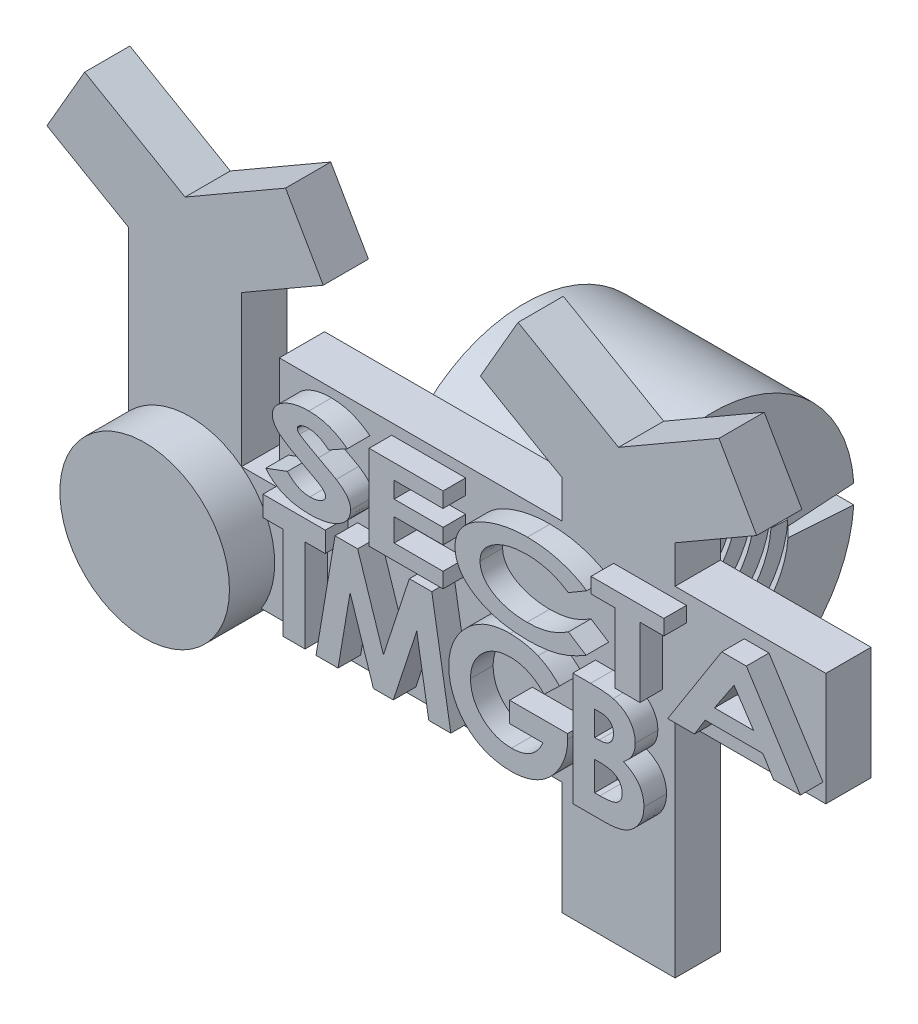
from build123d import *

# Parameters (mm, degrees)
SALIENTE_EXTRUIR1_DEPTH      = 2.4
SALIENTE_EXTRUIR2_DEPTH      = 2.4
SALIENTE_EXTRUIR2_DEPTH_BACK = 2.4
CROQUIS2_R                   = 4.5
SALIENTE_EXTRUIR3_DEPTH      = 1.2
SALIENTE_EXTRUIR4_START      = -15.5
SALIENTE_EXTRUIR4_DEPTH      = 10
REVOLUCI_N2_ANGLE            = 352.37185
SALIENTE_EXTRUIR5_DEPTH      = 1.2


# Read off the part's stored shape, not the designer's step: Revolución2
with BuildPart() as part:
    # Croquis1 → Saliente-Extruir1 (new body)
    with BuildSketch(Plane.XY):
        Polygon((-8, -12), (-14, -12), (-14, -6), (-37, -6), (-37, 8), (-41.330127019, 10.5), (-39.330127019, 13.964101615), (-34, 10.886751346), (-28.669872981, 13.964101615), (-26.669872981, 10.5), (-31, 8), (-31, 0), (-29, 0), (-29, 6), (-14, 6), (-14, 8), (-18.330127019, 10.5), (-16.330127019, 13.964101615), (-11, 10.886751346), (-5.669872981, 13.964101615), (-3.669872981, 10.5), (-8, 8), (-8, 6), (0, 6), (0, 0), (-8, 0), align=None)
    extrude(amount=SALIENTE_EXTRUIR1_DEPTH)

    # Croquis2 → Saliente-Extruir2 (add, two sides: drawn at the far end of the back side and taken through both)
    with BuildSketch(Plane.XY.offset(2.4).offset(-SALIENTE_EXTRUIR2_DEPTH_BACK)):
        with Locations((-33.744908232, -3.565877002)):
            Circle(CROQUIS2_R)
    extrude(amount=SALIENTE_EXTRUIR2_DEPTH + SALIENTE_EXTRUIR2_DEPTH_BACK)

    # Croquis4 → Saliente-Extruir3 (add)
    # profile 1 of 5: a face of its own
    with BuildSketch(Plane.XY.offset(2.4)):
        with BuildLine():
            Line((-24.192307692, 4.825075565), (-25.183894231, 4.27249143))
            add(Edge.make_bspline(
                [(-25.183894231, 4.27249143), (-25.226919521, 4.309235401), (-25.310921586, 4.380973891), (-25.44300624, 4.474503478), (-25.57494017, 4.554736812), (-25.707934149, 4.620047496), (-25.841884622, 4.67105453), (-25.976583426, 4.707083688), (-26.111905597, 4.729870519), (-26.20243685, 4.732645607), (-26.247596154, 4.734029892)],
                knots=[0, 0, 0, 0, 1.144796943, 2.235087903, 3.271950806, 4.267549238, 5.230026978, 6.168390537, 7.086346384, 8, 8, 8, 8], degree=3))
            add(Edge.make_bspline(
                [(-26.247596154, 4.734029892), (-26.289424602, 4.733153893), (-26.369562474, 4.731475594), (-26.484031555, 4.714354255), (-26.586771926, 4.685665755), (-26.6761846, 4.647005328), (-26.748660996, 4.600831216), (-26.803911953, 4.552167689), (-26.838911098, 4.497375224), (-26.84382007, 4.457984847), (-26.846153846, 4.439258257)],
                knots=[0, 0, 0, 0, 1.392129176, 2.667138632, 3.84227936, 4.935454925, 5.89858118, 6.691521191, 7.377935727, 8, 8, 8, 8], degree=3))
            add(Edge.make_bspline(
                [(-26.846153846, 4.439258257), (-26.844845537, 4.420373796), (-26.842149476, 4.381458201), (-26.816134665, 4.325733024), (-26.777704966, 4.271256116), (-26.742929276, 4.240270627), (-26.724459135, 4.223813546)],
                knots=[0, 0, 0, 0, 0.882707917, 1.819014285, 2.841630067, 4, 4, 4, 4], degree=3))
            add(Edge.make_bspline(
                [(-26.724459135, 4.223813546), (-26.70716928, 4.210697442), (-26.66689923, 4.180148536), (-26.59337581, 4.132820466), (-26.500289619, 4.0742192), (-26.385267259, 4.007155467), (-26.250202075, 3.929117481), (-26.092994818, 3.843681459), (-25.91659167, 3.74531642), (-25.790990693, 3.678511715), (-25.724759615, 3.643284699)],
                knots=[0, 0, 0, 0, 0.450074539, 1.048275106, 1.812777656, 2.732189609, 3.810011812, 5.048794557, 6.443789853, 8, 8, 8, 8], degree=3))
            add(Edge.make_bspline(
                [(-25.724759615, 3.643284699), (-25.662851598, 3.61054962), (-25.545567289, 3.548533238), (-25.379215317, 3.460234009), (-25.232592385, 3.380629208), (-25.104381152, 3.311837263), (-24.996313352, 3.251000464), (-24.90672063, 3.20082688), (-24.836479309, 3.15950506), (-24.796241404, 3.134624323), (-24.779146635, 3.12405393)],
                knots=[0, 0, 0, 0, 1.557729856, 2.951108395, 4.189202345, 5.268860485, 6.187465346, 6.947688418, 7.552933379, 8, 8, 8, 8], degree=3))
            add(Edge.make_bspline(
                [(-24.779146635, 3.12405393), (-24.745624529, 3.102367723), (-24.680599264, 3.060301409), (-24.588625488, 2.994912237), (-24.503390955, 2.931503644), (-24.427229566, 2.867043774), (-24.357014925, 2.805015658), (-24.29466236, 2.742739252), (-24.239952943, 2.680948997), (-24.177464976, 2.600954471), (-24.114353967, 2.498189698), (-24.058957494, 2.368077238), (-24.025432867, 2.231810055), (-24.021303487, 2.138659077), (-24.019230769, 2.091902488)],
                knots=[0, 0, 0, 0, 1.070878652, 2.077261218, 3.026806543, 3.919535016, 4.752941277, 5.539501526, 6.28186576, 6.965498631, 8.260851439, 9.503440935, 10.746866769, 12, 12, 12, 12], degree=3))
            add(Edge.make_bspline(
                [(-24.019230769, 2.091902488), (-24.021225883, 2.046388603), (-24.025162066, 1.956593709), (-24.053916989, 1.824825276), (-24.101962891, 1.699615496), (-24.170078124, 1.580956355), (-24.25688378, 1.468643362), (-24.361997442, 1.361487696), (-24.488019379, 1.263070384), (-24.629645969, 1.169520308), (-24.787082803, 1.085611466), (-24.956963559, 1.011461598), (-25.138821289, 0.94934789), (-25.33212297, 0.899368812), (-25.536835489, 0.859635813), (-25.752947944, 0.83114072), (-25.980779388, 0.81366997), (-26.136386151, 0.811872926), (-26.216045673, 0.810952969)],
                knots=[0, 0, 0, 0, 0.778645729, 1.536199556, 2.296471887, 3.065788088, 3.869161519, 4.720163113, 5.627776405, 6.600599383, 7.622238928, 8.677086202, 9.770036052, 10.907689888, 12.091823603, 13.337058766, 14.636764725, 16, 16, 16, 16], degree=3))
            add(Edge.make_bspline(
                [(-26.216045673, 0.810952969), (-26.278862692, 0.811613903), (-26.402188738, 0.812911487), (-26.584138058, 0.824072309), (-26.75981156, 0.841825212), (-26.929760665, 0.867140244), (-27.09350231, 0.899245573), (-27.251131566, 0.939142332), (-27.402545238, 0.985888772), (-27.54819372, 1.039742336), (-27.687679504, 1.102538784), (-27.822154113, 1.17262053), (-27.951366726, 1.251594628), (-28.076264597, 1.337864302), (-28.194814057, 1.433872974), (-28.309206927, 1.536758813), (-28.417527902, 1.648872099), (-28.485118563, 1.728831552), (-28.519230769, 1.769186142)],
                knots=[0, 0, 0, 0, 1.1656978, 2.288566092, 3.381684239, 4.4416263, 5.476209922, 6.477059963, 7.457759757, 8.415892537, 9.356930802, 10.29479133, 11.228214832, 12.165660798, 13.10971789, 14.057260176, 15.019522194, 16, 16, 16, 16], degree=3))
            Line((-28.519230769, 1.769186142), (-27.369891827, 2.195568353))
            add(Edge.make_bspline(
                [(-27.369891827, 2.195568353), (-27.326878803, 2.149617425), (-27.242766395, 2.059759915), (-27.104823389, 1.942623324), (-26.962827441, 1.842220632), (-26.815241766, 1.760731057), (-26.662944246, 1.696978834), (-26.505695985, 1.651714203), (-26.343252193, 1.623681536), (-26.232984667, 1.620335505), (-26.177283654, 1.618645276)],
                knots=[0, 0, 0, 0, 1.104549774, 2.159958392, 3.171518491, 4.154034384, 5.11440821, 6.064653456, 7.02237072, 8, 8, 8, 8], degree=3))
            add(Edge.make_bspline(
                [(-26.177283654, 1.618645276), (-26.120989658, 1.62005089), (-26.012343754, 1.622763687), (-25.85664514, 1.64771586), (-25.713942821, 1.686386449), (-25.607218871, 1.734622992), (-25.53095931, 1.778258902), (-25.482277778, 1.812604775), (-25.440114595, 1.847701985), (-25.405740827, 1.884529266), (-25.378809327, 1.92260654), (-25.360756038, 1.962489796), (-25.347985789, 2.003075864), (-25.346761569, 2.031110582), (-25.346153846, 2.045027488)],
                knots=[0, 0, 0, 0, 2.000080528, 3.860101882, 5.591711695, 7.241573856, 8.007496713, 8.712915002, 9.3571957, 9.95440764, 10.499672279, 11.006310789, 11.506715953, 12, 12, 12, 12], degree=3))
            add(Edge.make_bspline(
                [(-25.346153846, 2.045027488), (-25.348239201, 2.070942283), (-25.352586387, 2.124964954), (-25.390964671, 2.203007862), (-25.448179949, 2.280722516), (-25.514214503, 2.343308112), (-25.582059449, 2.395058844), (-25.647383562, 2.441422812), (-25.726444628, 2.492094868), (-25.819005406, 2.548325637), (-25.925335169, 2.609220624), (-26.044860486, 2.67577012), (-26.17800202, 2.747266769), (-26.271568792, 2.795754085), (-26.320612981, 2.821169315)],
                knots=[0, 0, 0, 0, 0.719620744, 1.500140495, 2.382110041, 3.407752025, 4.023146351, 4.762800511, 5.641737031, 6.64237355, 7.784062873, 9.059959673, 10.45894125, 12, 12, 12, 12], degree=3))
            add(Edge.make_bspline(
                [(-26.320612981, 2.821169315), (-26.368459463, 2.84567455), (-26.462008447, 2.89358695), (-26.598052081, 2.966124363), (-26.728282458, 3.035606872), (-26.852361866, 3.102717503), (-26.969340368, 3.16861793), (-27.079874913, 3.232097137), (-27.184213841, 3.292789495), (-27.281477135, 3.352655417), (-27.372939784, 3.409563727), (-27.457987116, 3.463803993), (-27.536153138, 3.516806133), (-27.608250882, 3.56691886), (-27.673715651, 3.615399427), (-27.732827542, 3.661463412), (-27.784903573, 3.705640291), (-27.845809442, 3.760123378), (-27.91153798, 3.827869305), (-27.981090217, 3.909608617), (-28.039650506, 3.991311051), (-28.088116794, 4.07325264), (-28.126508849, 4.154820462), (-28.152520589, 4.237055511), (-28.169956374, 4.318632083), (-28.172042788, 4.37336685), (-28.173076923, 4.400496238)],
                knots=[0, 0, 0, 0, 1.527752317, 2.987046655, 4.381534809, 5.722815918, 6.996037519, 8.197198144, 9.345466108, 10.426340658, 11.442891163, 12.407010941, 13.292840506, 14.126765819, 14.902190045, 15.60773904, 16.256140062, 16.842652159, 17.929649168, 18.935598672, 19.890598399, 20.782540177, 21.638432253, 22.445922123, 23.229718433, 24, 24, 24, 24], degree=3))
            add(Edge.make_bspline(
                [(-28.173076923, 4.400496238), (-28.171332958, 4.439115335), (-28.167872434, 4.515746655), (-28.140274372, 4.628176318), (-28.096954996, 4.736645399), (-28.034402099, 4.840036268), (-27.954790236, 4.939178338), (-27.857594728, 5.03372198), (-27.743147048, 5.123864571), (-27.613030887, 5.208721489), (-27.469978861, 5.28611098), (-27.317394775, 5.354995406), (-27.156225026, 5.412373324), (-26.987382795, 5.460394313), (-26.810220466, 5.497174122), (-26.625035089, 5.523120736), (-26.431752744, 5.538517619), (-26.300208347, 5.540640417), (-26.233173077, 5.541722199)],
                knots=[0, 0, 0, 0, 0.750986067, 1.490170878, 2.240724014, 3.017156197, 3.83291239, 4.709793601, 5.650705905, 6.664670556, 7.729957895, 8.813839263, 9.920261115, 11.057155333, 12.228423976, 13.439459984, 14.695144019, 16, 16, 16, 16], degree=3))
            add(Edge.make_bspline(
                [(-26.233173077, 5.541722199), (-26.1459499, 5.539811999), (-25.973426712, 5.536033716), (-25.71789947, 5.506014802), (-25.468743649, 5.458927461), (-25.265554368, 5.401927605), (-25.104286181, 5.345639344), (-24.980879285, 5.295174591), (-24.855593259, 5.235928582), (-24.726973154, 5.170437519), (-24.596827454, 5.094993964), (-24.463217184, 5.013324641), (-24.327779063, 4.922853281), (-24.238080357, 4.85811241), (-24.192307692, 4.825075565)],
                knots=[0, 0, 0, 0, 1.424089512, 2.816779558, 4.195891129, 5.561527259, 6.25835624, 6.984627267, 7.737611116, 8.521108524, 9.34096556, 10.193521101, 11.07816558, 12, 12, 12, 12], degree=3))
        make_face()
    # profile 2 of 5: a face of its own
    with BuildSketch(Plane.XY.offset(2.4)):
        Polygon((-23.035576923, 5.426337584), (-19.1125, 5.426337584), (-19.1125, 4.618645276), (-21.708653846, 4.618645276), (-21.708653846, 3.753260661), (-19.1125, 3.753260661), (-19.1125, 2.945568353), (-21.708653846, 2.945568353), (-21.708653846, 1.734029892), (-19.1125, 1.734029892), (-19.1125, 0.926337584), (-23.035576923, 0.926337584), align=None)
    # profile 3 of 5: a face of its own
    with BuildSketch(Plane.XY.offset(2.4)):
        with BuildLine():
            Line((-11.494230769, 4.645688546), (-12.461478365, 4.079582776))
            add(Edge.make_bspline(
                [(-12.461478365, 4.079582776), (-12.544289436, 4.131887712), (-12.70893723, 4.235882169), (-12.967709373, 4.369570214), (-13.2349627, 4.481070871), (-13.508945238, 4.574844948), (-13.791643594, 4.64568237), (-14.081359757, 4.697070998), (-14.379043474, 4.728675173), (-14.580090964, 4.732231823), (-14.681730769, 4.734029892)],
                knots=[0, 0, 0, 0, 1.000465043, 1.98915872, 2.971640436, 3.957111076, 4.945256385, 5.94622067, 6.961709345, 8, 8, 8, 8], degree=3))
            add(Edge.make_bspline(
                [(-14.681730769, 4.734029892), (-14.766807302, 4.732614733), (-14.933613121, 4.729840095), (-15.178736129, 4.708948819), (-15.41352726, 4.673751146), (-15.638708179, 4.625507751), (-15.853448947, 4.562274824), (-16.058280977, 4.48569033), (-16.25235326, 4.394501415), (-16.434067486, 4.290723345), (-16.600277398, 4.177562223), (-16.746196027, 4.055929366), (-16.870201552, 3.927577603), (-16.971329203, 3.792162), (-17.051341788, 3.650423272), (-17.107374496, 3.501164008), (-17.142253146, 3.345315182), (-17.146123081, 3.239018692), (-17.148076923, 3.185352007)],
                knots=[0, 0, 0, 0, 1.273167119, 2.496242804, 3.678550535, 4.824339787, 5.939965159, 7.025799381, 8.094030328, 9.145459928, 10.154579224, 11.099447358, 11.983659447, 12.819211474, 13.622469174, 14.41092516, 15.197712182, 16, 16, 16, 16], degree=3))
            add(Edge.make_bspline(
                [(-17.148076923, 3.185352007), (-17.147415614, 3.147727083), (-17.146108387, 3.073352918), (-17.129475318, 2.96370395), (-17.106065882, 2.856804626), (-17.070101266, 2.75393244), (-17.025862091, 2.65391101), (-16.971328936, 2.557174091), (-16.907261742, 2.463244728), (-16.833169017, 2.37324015), (-16.74995472, 2.287330187), (-16.657794645, 2.206639788), (-16.558275277, 2.129695963), (-16.45080782, 2.057129788), (-16.334226304, 1.991157083), (-16.210216908, 1.928324455), (-16.077791861, 1.871334993), (-15.938537212, 1.817777173), (-15.792564168, 1.771701839), (-15.642458064, 1.729774273), (-15.487700082, 1.69568223), (-15.329102464, 1.668203354), (-15.166867918, 1.644955994), (-15.000433419, 1.63053195), (-14.830012806, 1.619621949), (-14.714802376, 1.618973486), (-14.656490385, 1.618645276)],
                knots=[0, 0, 0, 0, 0.830945717, 1.642551973, 2.446594014, 3.246896049, 4.046756933, 4.861591236, 5.698014292, 6.556999256, 7.435410672, 8.338952563, 9.262321444, 10.214761384, 11.20258315, 12.221471147, 13.286409055, 14.388022435, 15.518142965, 16.668710983, 17.832243558, 19.019275871, 20.22635821, 21.453738207, 22.71124865, 24, 24, 24, 24], degree=3))
            add(Edge.make_bspline(
                [(-14.656490385, 1.618645276), (-14.558479025, 1.620411909), (-14.366006122, 1.623881189), (-14.084005172, 1.650038065), (-13.814796067, 1.694421697), (-13.598352905, 1.745650094), (-13.428470487, 1.797304223), (-13.29967663, 1.845079594), (-13.16705737, 1.897774166), (-13.031696922, 1.95876245), (-12.892716193, 2.025958407), (-12.751716033, 2.102246686), (-12.606883075, 2.184160309), (-12.51058721, 2.243056557), (-12.461478365, 2.273092392)],
                knots=[0, 0, 0, 0, 1.517099692, 2.97925243, 4.379421106, 5.737784246, 6.419017464, 7.126793621, 7.863581755, 8.627744198, 9.42450828, 10.252748223, 11.108938718, 12, 12, 12, 12], degree=3))
            Line((-12.461478365, 2.273092392), (-11.523978365, 1.670027488))
            add(Edge.make_bspline(
                [(-11.523978365, 1.670027488), (-11.589866389, 1.63089097), (-11.719693426, 1.55377562), (-11.915195728, 1.446317988), (-12.108473976, 1.34948377), (-12.297754192, 1.259261056), (-12.485165811, 1.179927018), (-12.670221171, 1.111080552), (-12.851582723, 1.048595885), (-13.032422653, 0.997560002), (-13.21480409, 0.952437403), (-13.402047536, 0.915306611), (-13.595238215, 0.882366907), (-13.794974582, 0.856691538), (-14.000848718, 0.835695517), (-14.213133376, 0.821796079), (-14.43134112, 0.812187513), (-14.578955449, 0.81136827), (-14.653786058, 0.810952969)],
                knots=[0, 0, 0, 0, 1.116919084, 2.20079896, 3.250609473, 4.267388355, 5.256504417, 6.215552819, 7.144850743, 8.051425286, 8.95323759, 9.882566473, 10.832956071, 11.809130983, 12.817090507, 13.848664173, 14.909416376, 16, 16, 16, 16], degree=3))
            add(Edge.make_bspline(
                [(-14.653786058, 0.810952969), (-14.722906065, 0.811438621), (-14.859691786, 0.812399709), (-15.062555949, 0.821077022), (-15.260983826, 0.833250386), (-15.454582999, 0.851296303), (-15.643403282, 0.874597786), (-15.827259539, 0.903853507), (-16.00674088, 0.936332544), (-16.180825441, 0.976788095), (-16.350605366, 1.020454944), (-16.515219787, 1.070284035), (-16.675796791, 1.124137214), (-16.830986852, 1.184720215), (-16.98194907, 1.249284398), (-17.127583541, 1.320151969), (-17.268666888, 1.395536662), (-17.404785058, 1.475557845), (-17.533832281, 1.55977608), (-17.655328935, 1.647304488), (-17.767608154, 1.738530782), (-17.872942194, 1.831381532), (-17.969705449, 1.927659287), (-18.056733746, 2.028066389), (-18.136984543, 2.130125749), (-18.207982429, 2.23578825), (-18.271536331, 2.343875109), (-18.325588208, 2.45528507), (-18.371881381, 2.569350723), (-18.409889173, 2.686463496), (-18.438566401, 2.80681331), (-18.459258447, 2.929679867), (-18.472299239, 3.055565471), (-18.474092593, 3.140548909), (-18.475, 3.183549122)],
                knots=[0, 0, 0, 0, 1.332695775, 2.637351488, 3.914573827, 5.165626706, 6.385872522, 7.582268218, 8.755001435, 9.901903064, 11.027533841, 12.134657037, 13.217484645, 14.292362361, 15.346028539, 16.38254251, 17.414187142, 18.429713001, 19.426050768, 20.38448865, 21.315585414, 22.214377371, 23.09110566, 23.945180852, 24.774994998, 25.592932072, 26.397837579, 27.190746929, 27.978303889, 28.769836126, 29.562406716, 30.361557218, 31.170975064, 32, 32, 32, 32], degree=3))
            add(Edge.make_bspline(
                [(-18.475, 3.183549122), (-18.473785493, 3.238925736), (-18.471371684, 3.348985679), (-18.446835338, 3.511020848), (-18.408980933, 3.668635775), (-18.355790343, 3.821267368), (-18.28636546, 3.9692084), (-18.202723551, 4.112393918), (-18.103189381, 4.250700647), (-17.988581396, 4.383672271), (-17.859872774, 4.511467458), (-17.71720785, 4.632192986), (-17.563026633, 4.748488266), (-17.393828314, 4.855888833), (-17.21236255, 4.957872305), (-17.017950151, 5.05352182), (-16.810256436, 5.142613144), (-16.59063275, 5.224912925), (-16.362332555, 5.299148216), (-16.12837035, 5.364251973), (-15.889855412, 5.419259798), (-15.647178925, 5.464408476), (-15.399824695, 5.498220768), (-15.148529856, 5.52396688), (-14.892531391, 5.538130641), (-14.720508462, 5.540519988), (-14.633954327, 5.541722199)],
                knots=[0, 0, 0, 0, 0.802734483, 1.595419208, 2.3713548, 3.151550955, 3.93542733, 4.738280132, 5.553519112, 6.40352961, 7.281897666, 8.181549112, 9.112540013, 10.080976543, 11.086002615, 12.130796417, 13.222189586, 14.362844853, 15.53167316, 16.70335042, 17.8843298, 19.081152094, 20.282513389, 21.504662868, 22.744459539, 24, 24, 24, 24], degree=3))
            add(Edge.make_bspline(
                [(-14.633954327, 5.541722199), (-14.560022202, 5.541038651), (-14.412680101, 5.539676383), (-14.192915704, 5.528419291), (-13.974866237, 5.510811627), (-13.759430794, 5.484144557), (-13.545483627, 5.45221806), (-13.334339569, 5.411070758), (-13.124506008, 5.364772576), (-12.918162654, 5.309484781), (-12.715876611, 5.248900726), (-12.520332919, 5.18093532), (-12.331084533, 5.108255242), (-12.149648163, 5.028005632), (-11.974851405, 4.94211841), (-11.807351876, 4.850530483), (-11.646999565, 4.75209108), (-11.544984001, 4.681037862), (-11.494230769, 4.645688546)],
                knots=[0, 0, 0, 0, 1.07027023, 2.132981633, 3.184963682, 4.2365859, 5.275089204, 6.31594048, 7.35020766, 8.385325281, 9.407824875, 10.406591267, 11.38165812, 12.34189163, 13.277662355, 14.200461515, 15.104720988, 16, 16, 16, 16], degree=3))
        make_face()
    # profile 4 of 5: a face of its own
    with BuildSketch(Plane.XY.offset(2.4)):
        Polygon((-11.260576923, 5.426337584), (-7.395192308, 5.426337584), (-7.395192308, 4.618645276), (-8.664423077, 4.618645276), (-8.664423077, 0.926337584), (-9.991346154, 0.926337584), (-9.991346154, 4.618645276), (-11.260576923, 4.618645276), align=None)
    # profile 5 of 5: a face of its own
    with BuildSketch(Plane.XY.offset(2.4)):
        Polygon((-4.322896635, 5.426337584), (-3.017608173, 5.426337584), (-0.151923077, 0.926337584), (-1.574399038, 0.926337584), (-2.138701923, 1.849414507), (-5.204507212, 1.849414507), (-5.768810096, 0.926337584), (-7.190384615, 0.926337584), align=None)
        Polygon((-3.671153846, 4.219306334), (-4.710516827, 2.657106815), (-2.631790865, 2.657106815), align=None, mode=Mode.SUBTRACT)
    extrude(amount=SALIENTE_EXTRUIR3_DEPTH)

    # Croquis5 → Saliente-Extruir4 (add)
    with BuildSketch(Plane.ZY.offset(29).offset(SALIENTE_EXTRUIR4_START)):
        with BuildLine():
            Line((0, 5.499090834), (0, -5.499090834))
            ThreePointArc((0, -5.499090834), (-7.869590412, -6.969890168), (-12.583388684, -0.498892579))
            Line((-12.583388684, -0.498892579), (-10.088925789, -0.332595053))
            ThreePointArc((-10.088925789, -0.332595053), (-0.1, 0), (-10.088925789, 0.332595053))
            Line((-10.088925789, 0.332595053), (-12.583388684, 0.498892579))
            ThreePointArc((-12.583388684, 0.498892579), (-7.869590412, 6.969890168), (0, 5.499090834))
        make_face()
    extrude(amount=SALIENTE_EXTRUIR4_DEPTH)

    # Revolución2 outline → Revolución2 (revolve)
    with BuildSketch(Plane(origin=(0, 0, -5.1), x_dir=(0, 0.06651901052375865, -0.9977851578566099), z_dir=(0, -0.9977851578566099, -0.06651901052375865))):
        Polygon((4.9, -22.6), (4, -23.5), (5, -23.5), (5, -18.9), (4, -19.9), (4.9, -19.9), (4, -20.8), (4.9, -20.8), (4, -21.7), (4.9, -21.7), (4, -22.6), align=None)
        Polygon((4, -17.1), (5, -18.1), (5, -13.5), (4, -13.5), (4.9, -14.4), (4, -14.4), (4.9, -15.3), (4, -15.3), (4.9, -16.2), (4, -16.2), (4.9, -17.1), align=None)
    revolve(axis=Axis((0, 0, -5.1), (1, 0, 0)), revolution_arc=REVOLUCI_N2_ANGLE)

    # Croquis8 → Saliente-Extruir5 (add)
    # profile 1 of 4: a face of its own
    with BuildSketch(Plane.XY.offset(2.4)):
        Polygon((-28.667985155, 0.5), (-25.360292848, 0.5), (-25.360292848, -0.576923077), (-26.437215925, -0.576923077), (-26.437215925, -5.5), (-27.591062079, -5.5), (-27.591062079, -0.576923077), (-28.667985155, -0.576923077), align=None)
    # profile 2 of 4: a face of its own
    with BuildSketch(Plane.XY.offset(2.4)):
        Polygon((-24.842985155, 0.5), (-23.642264002, 0.5), (-22.275677463, -3.685096154), (-20.900677463, 0.5), (-19.709571694, 0.5), (-18.698754386, -5.5), (-19.86822554, -5.5), (-20.506446694, -1.710336538), (-21.751639002, -5.5), (-22.806927463, -5.5), (-24.044908232, -1.710336538), (-24.683129386, -5.5), (-25.85260054, -5.5), align=None)
    # profile 3 of 4: a face of its own
    with BuildSketch(Plane.XY.offset(2.4)):
        with BuildLine():
            Line((-12.93385054, -0.454326923), (-13.747552463, -1.234375))
            add(Edge.make_bspline(
                [(-13.747552463, -1.234375), (-13.812112854, -1.169830889), (-13.938570004, -1.043405626), (-14.144449324, -0.878092032), (-14.357916841, -0.737514506), (-14.580237049, -0.622497015), (-14.810798556, -0.533253046), (-15.049161508, -0.468853084), (-15.295629587, -0.431174263), (-15.462570363, -0.425793025), (-15.546831309, -0.423076923)],
                knots=[0, 0, 0, 0, 1.077854603, 2.111239107, 3.112875773, 4.092989285, 5.062485546, 6.028057243, 7.004690375, 8, 8, 8, 8], degree=3))
            add(Edge.make_bspline(
                [(-15.546831309, -0.423076923), (-15.620231528, -0.424970211), (-15.764359292, -0.428687847), (-15.975790131, -0.456587062), (-16.177685383, -0.503862719), (-16.371233565, -0.568681101), (-16.555291826, -0.652963983), (-16.730085799, -0.756122767), (-16.895014573, -0.878411067), (-17.050015805, -1.016686285), (-17.191222349, -1.168138612), (-17.314405663, -1.330252365), (-17.419748658, -1.499593893), (-17.504598753, -1.678412008), (-17.570139981, -1.864698627), (-17.619474357, -2.058755599), (-17.646784558, -2.261235137), (-17.650644599, -2.398961804), (-17.65260054, -2.46875)],
                knots=[0, 0, 0, 0, 1.076174766, 2.113163489, 3.120708921, 4.11282258, 5.101328764, 6.08374035, 7.083720487, 8.107341985, 9.125842004, 10.115238207, 11.08863139, 12.045194875, 13.011469914, 13.980420384, 14.976648303, 16, 16, 16, 16], degree=3))
            add(Edge.make_bspline(
                [(-17.65260054, -2.46875), (-17.650962275, -2.54098602), (-17.64773467, -2.683300868), (-17.615933144, -2.891992125), (-17.568805463, -3.092897754), (-17.499822777, -3.2852237), (-17.409903779, -3.468204579), (-17.302718788, -3.644070864), (-17.174226974, -3.810177564), (-17.028296578, -3.966332139), (-16.869202349, -4.11011881), (-16.696897305, -4.234257618), (-16.516774701, -4.340977827), (-16.326426671, -4.426063045), (-16.127968396, -4.494548759), (-15.91961292, -4.541820752), (-15.702342943, -4.571644778), (-15.554541961, -4.57514599), (-15.479523617, -4.576923077)],
                knots=[0, 0, 0, 0, 1.026657221, 2.022655271, 2.995600565, 3.958044271, 4.921330969, 5.890766047, 6.882288119, 7.902298494, 8.92724657, 9.926807723, 10.917740208, 11.899554952, 12.887008282, 13.898773044, 14.93349446, 16, 16, 16, 16], degree=3))
            add(Edge.make_bspline(
                [(-15.479523617, -4.576923077), (-15.430610301, -4.576475439), (-15.33459569, -4.575596746), (-15.193774247, -4.561460062), (-15.058610693, -4.540978069), (-14.928754133, -4.514570225), (-14.805611406, -4.475980513), (-14.687698689, -4.43258476), (-14.576281115, -4.378753796), (-14.470281809, -4.31775154), (-14.369613074, -4.247046055), (-14.273744057, -4.168123432), (-14.182969776, -4.079605138), (-14.097560402, -3.981823322), (-14.017060715, -3.875055168), (-13.94268207, -3.758352219), (-13.870943354, -3.633909478), (-13.829816144, -3.545214462), (-13.80885054, -3.5)],
                knots=[0, 0, 0, 0, 1.106134038, 2.171290733, 3.198078673, 4.198935483, 5.165211904, 6.11467776, 7.039021133, 7.960917088, 8.878704592, 9.818735339, 10.767378828, 11.743678385, 12.753402092, 13.789231532, 14.873006512, 16, 16, 16, 16], degree=3))
            Line((-13.80885054, -3.5), (-15.575677463, -3.5))
            Line((-15.575677463, -3.5), (-15.575677463, -2.423076923))
            Line((-15.575677463, -2.423076923), (-12.507167848, -2.423076923))
            Line((-12.507167848, -2.423076923), (-12.498754386, -2.679086538))
            add(Edge.make_bspline(
                [(-12.498754386, -2.679086538), (-12.49982863, -2.744837737), (-12.5019752, -2.876222794), (-12.521819016, -3.071807114), (-12.554153367, -3.264990333), (-12.600351367, -3.455114342), (-12.657910369, -3.643186158), (-12.728728363, -3.828448389), (-12.814046951, -4.010414665), (-12.908828852, -4.189619739), (-13.01549955, -4.36140546), (-13.129923719, -4.524620208), (-13.252427104, -4.67714513), (-13.382452766, -4.819317408), (-13.519796711, -4.951077527), (-13.665458876, -5.071279894), (-13.818811936, -5.180745699), (-13.978388446, -5.280971832), (-14.146229319, -5.369254784), (-14.321910129, -5.444204207), (-14.503844707, -5.509845032), (-14.693100814, -5.562530162), (-14.889444879, -5.603538988), (-15.092681627, -5.631589874), (-15.302879929, -5.650669896), (-15.445425358, -5.652774731), (-15.517985155, -5.653846154)],
                knots=[0, 0, 0, 0, 1.000854805, 1.999923498, 2.989712597, 3.980985513, 4.976603181, 5.982575395, 6.997825886, 8.034815498, 9.067436244, 10.074388172, 11.068004371, 12.04376582, 13.005875286, 13.963410267, 14.916446417, 15.872756543, 16.830466376, 17.800433386, 18.778651356, 19.773240735, 20.788930934, 21.830163881, 22.895489874, 24, 24, 24, 24], degree=3))
            add(Edge.make_bspline(
                [(-15.517985155, -5.653846154), (-15.5957502, -5.652815737), (-15.749122505, -5.650783495), (-15.976310985, -5.630896323), (-16.197000549, -5.598579009), (-16.411375051, -5.554186107), (-16.61939321, -5.497460453), (-16.82121032, -5.428184422), (-17.01633317, -5.344475863), (-17.2050258, -5.2500873), (-17.385200531, -5.142997462), (-17.556347131, -5.025036163), (-17.717815072, -4.896123053), (-17.869609754, -4.756337451), (-18.011430694, -4.606167022), (-18.143321885, -4.444939848), (-18.265785494, -4.273096443), (-18.378270185, -4.091246781), (-18.478635773, -3.901958331), (-18.566964481, -3.708386394), (-18.640290152, -3.510581416), (-18.700145833, -3.309271449), (-18.748981263, -3.104849702), (-18.782489918, -2.89635135), (-18.801725696, -2.684258893), (-18.804866042, -2.541704711), (-18.806446694, -2.469951923)],
                knots=[0, 0, 0, 0, 1.094077496, 2.157797094, 3.206243057, 4.231204677, 5.236440406, 6.238430035, 7.231130052, 8.221987358, 9.205293845, 10.177989532, 11.144736355, 12.110282423, 13.079393496, 14.048848873, 15.039112577, 16.046669561, 17.055487567, 18.052102, 19.038571084, 20.021360263, 21.005942692, 21.993957109, 22.990284475, 24, 24, 24, 24], degree=3))
            add(Edge.make_bspline(
                [(-18.806446694, -2.469951923), (-18.804291089, -2.372073841), (-18.800034408, -2.178793647), (-18.761562423, -1.893897367), (-18.699315488, -1.618577522), (-18.611254593, -1.353393522), (-18.498288503, -1.098239421), (-18.362649596, -0.85188182), (-18.199250474, -0.616331909), (-18.074161748, -0.469725042), (-18.010773617, -0.395432692)],
                knots=[0, 0, 0, 0, 1.032304419, 2.03849517, 3.02704725, 4.006893449, 4.981629129, 5.967438858, 6.97000907, 8, 8, 8, 8], degree=3))
            add(Edge.make_bspline(
                [(-18.010773617, -0.395432692), (-17.971202128, -0.352482015), (-17.892640142, -0.267211265), (-17.767093129, -0.148841382), (-17.638397623, -0.037031753), (-17.503825016, 0.064052893), (-17.365940174, 0.159075853), (-17.223315065, 0.245070465), (-17.076252085, 0.323692528), (-16.924512415, 0.393437967), (-16.768351393, 0.454691162), (-16.607679877, 0.507365553), (-16.44318219, 0.553882069), (-16.273073496, 0.588978052), (-16.099157405, 0.618400552), (-15.920956987, 0.638009069), (-15.738577906, 0.652557237), (-15.615371591, 0.653412224), (-15.552840925, 0.653846154)],
                knots=[0, 0, 0, 0, 1.016118339, 2.017317938, 3.001275297, 3.981668478, 4.944825547, 5.914648143, 6.878536893, 7.845723926, 8.819449042, 9.796265041, 10.787606614, 11.792780397, 12.817593949, 13.856355671, 14.912040269, 16, 16, 16, 16], degree=3))
            add(Edge.make_bspline(
                [(-15.552840925, 0.653846154), (-15.487513357, 0.652850309), (-15.357528824, 0.650868841), (-15.164238707, 0.637177861), (-14.973613351, 0.616007505), (-14.786778175, 0.584504163), (-14.602909533, 0.545011929), (-14.422975969, 0.49540107), (-14.245554212, 0.437971225), (-14.129954233, 0.392806781), (-14.072071694, 0.370192308)],
                knots=[0, 0, 0, 0, 1.033296363, 2.055985719, 3.063761252, 4.06602213, 5.05173728, 6.037207936, 7.017202351, 8, 8, 8, 8], degree=3))
            add(Edge.make_bspline(
                [(-14.072071694, 0.370192308), (-14.023239823, 0.349301567), (-13.924287252, 0.306968713), (-13.780702128, 0.228796667), (-13.636940828, 0.142052007), (-13.493579066, 0.044824269), (-13.352400645, -0.065008385), (-13.211277438, -0.18451753), (-13.070407127, -0.313948063), (-12.979884545, -0.407004408), (-12.93385054, -0.454326923)],
                knots=[0, 0, 0, 0, 0.900000664, 1.823755199, 2.768472877, 3.746235677, 4.758381446, 5.79940171, 6.880916228, 8, 8, 8, 8], degree=3))
        make_face()
    # profile 4 of 4: a face of its own
    with BuildSketch(Plane.XY.offset(2.4)):
        with BuildLine():
            Line((-12.221831309, -5.5), (-12.221831309, 0.5))
            Line((-12.221831309, 0.5), (-11.281927463, 0.5))
            add(Edge.make_bspline(
                [(-11.281927463, 0.5), (-11.216215915, 0.500013475), (-11.089168713, 0.500039527), (-10.905261178, 0.49335105), (-10.734980694, 0.484988617), (-10.578504948, 0.475294702), (-10.435958574, 0.458809962), (-10.306730885, 0.441557313), (-10.190985277, 0.420648494), (-10.119571999, 0.401858501), (-10.086014002, 0.393028846)],
                knots=[0, 0, 0, 0, 1.309958458, 2.532683521, 3.668272032, 4.709119842, 5.657335947, 6.52825595, 7.308408961, 8, 8, 8, 8], degree=3))
            add(Edge.make_bspline(
                [(-10.086014002, 0.393028846), (-10.042099912, 0.380544086), (-9.95557951, 0.355946366), (-9.831530917, 0.306767707), (-9.71381817, 0.252271171), (-9.603292509, 0.18906756), (-9.499634014, 0.117872578), (-9.402361912, 0.039069482), (-9.313122152, -0.048581047), (-9.230197528, -0.141721669), (-9.155774851, -0.241413774), (-9.0906791, -0.345788074), (-9.036262659, -0.454959609), (-8.991583693, -0.56836752), (-8.956956032, -0.686278695), (-8.931254009, -0.80836097), (-8.916883321, -0.935148116), (-8.91506335, -1.021199172), (-8.914139002, -1.064903846)],
                knots=[0, 0, 0, 0, 1.083744238, 2.135214176, 3.165411979, 4.162783227, 5.155239493, 6.149518955, 7.132025418, 8.123020711, 9.108885551, 10.083293978, 11.040828255, 12.002137941, 12.97468592, 13.956362524, 14.962052124, 16, 16, 16, 16], degree=3))
            add(Edge.make_bspline(
                [(-8.914139002, -1.064903846), (-8.916192331, -1.121073822), (-8.920234059, -1.231637517), (-8.946052889, -1.394035581), (-8.994467218, -1.547525095), (-9.05781619, -1.69493481), (-9.143950986, -1.835714889), (-9.253325519, -1.969798393), (-9.384168279, -2.101313955), (-9.484531899, -2.180148664), (-9.536735155, -2.221153846)],
                knots=[0, 0, 0, 0, 0.986156485, 1.941127874, 2.875419072, 3.804401753, 4.751181392, 5.761612777, 6.835722519, 8, 8, 8, 8], degree=3))
            add(Edge.make_bspline(
                [(-9.536735155, -2.221153846), (-9.491198561, -2.242672398), (-9.402197957, -2.284730091), (-9.275821128, -2.35525722), (-9.157553717, -2.427461573), (-9.050416403, -2.506621144), (-8.951578528, -2.587923402), (-8.861910305, -2.673483186), (-8.782530242, -2.763754738), (-8.712567562, -2.858072041), (-8.650705173, -2.95590408), (-8.597531342, -3.058420247), (-8.553684839, -3.165746868), (-8.515305633, -3.276485263), (-8.488603368, -3.392311811), (-8.468125287, -3.511871323), (-8.453940708, -3.635880452), (-8.453052123, -3.720312419), (-8.45260054, -3.763221154)],
                knots=[0, 0, 0, 0, 1.202516986, 2.35030176, 3.454834929, 4.509371854, 5.528678407, 6.509954211, 7.465897614, 8.395966456, 9.311850086, 10.227683732, 11.149942961, 12.078879044, 13.023453234, 13.984602273, 14.975765119, 16, 16, 16, 16], degree=3))
            add(Edge.make_bspline(
                [(-8.45260054, -3.763221154), (-8.455981428, -3.845168918), (-8.462653595, -4.006892501), (-8.511437231, -4.244339863), (-8.596012554, -4.469461499), (-8.709579774, -4.681362679), (-8.849516438, -4.873909212), (-9.010403473, -5.042578303), (-9.190621115, -5.185352944), (-9.356893672, -5.28171475), (-9.50070634, -5.346382533), (-9.619823685, -5.386364235), (-9.747753189, -5.423403223), (-9.886838214, -5.449412765), (-10.034557336, -5.473219558), (-10.192350828, -5.487918365), (-10.359923775, -5.497879384), (-10.475020118, -5.499278837), (-10.534331309, -5.5)],
                knots=[0, 0, 0, 0, 1.284142165, 2.534249414, 3.780121997, 5.041676246, 6.291546858, 7.49970053, 8.684500223, 9.883330709, 10.50184324, 11.153274765, 11.851151195, 12.587658647, 13.369265475, 14.195992086, 15.070362669, 16, 16, 16, 16], degree=3))
            Line((-10.534331309, -5.5), (-12.221831309, -5.5))
        make_face()
        with BuildLine():
            Line((-11.067985155, -0.576923077), (-11.067985155, -1.884615385))
            Line((-11.067985155, -1.884615385), (-10.834812079, -1.884615385))
            add(Edge.make_bspline(
                [(-10.834812079, -1.884615385), (-10.7736902, -1.883136088), (-10.659101769, -1.880362772), (-10.499854252, -1.844609949), (-10.363914271, -1.789357368), (-10.254235631, -1.70780429), (-10.169408326, -1.607124874), (-10.109564327, -1.488629722), (-10.074444083, -1.353746539), (-10.070195736, -1.258628323), (-10.067985155, -1.209134615)],
                knots=[0, 0, 0, 0, 1.258401003, 2.359191202, 3.347790158, 4.263507911, 5.14919641, 6.03996009, 6.980115012, 8, 8, 8, 8], degree=3))
            add(Edge.make_bspline(
                [(-10.067985155, -1.209134615), (-10.069735808, -1.162825682), (-10.073091747, -1.074053105), (-10.107830453, -0.948302844), (-10.164919101, -0.837519876), (-10.245991696, -0.743364505), (-10.349779804, -0.66677787), (-10.477624664, -0.612893873), (-10.628275706, -0.582531787), (-10.735708054, -0.578868138), (-10.792744771, -0.576923077)],
                knots=[0, 0, 0, 0, 1.014306277, 1.944389011, 2.837187864, 3.728946864, 4.646980519, 5.643405889, 6.748864797, 8, 8, 8, 8], degree=3))
            Line((-10.792744771, -0.576923077), (-11.067985155, -0.576923077))
        make_face(mode=Mode.SUBTRACT)
        with BuildLine():
            Line((-11.067985155, -2.884615385), (-11.067985155, -4.423076923))
            Line((-11.067985155, -4.423076923), (-10.787937079, -4.423076923))
            add(Edge.make_bspline(
                [(-10.787937079, -4.423076923), (-10.732237317, -4.422745475), (-10.625574438, -4.422110764), (-10.472353706, -4.413764947), (-10.333597363, -4.399490563), (-10.208655566, -4.380695473), (-10.097941965, -4.356079894), (-10.001467086, -4.324834796), (-9.918539846, -4.289506994), (-9.849351127, -4.246689117), (-9.792742929, -4.197252911), (-9.742150746, -4.145371134), (-9.699872089, -4.086998255), (-9.66528899, -4.02356055), (-9.637936816, -3.955064994), (-9.621126465, -3.881197622), (-9.607920532, -3.802948527), (-9.606945926, -3.748860077), (-9.606446694, -3.721153846)],
                knots=[0, 0, 0, 0, 1.70481772, 3.264659739, 4.694829706, 5.973130519, 7.130401762, 8.16200361, 9.073479184, 9.883341596, 10.640215769, 11.368843259, 12.097367536, 12.838276129, 13.57613361, 14.34649896, 15.153011743, 16, 16, 16, 16], degree=3))
            add(Edge.make_bspline(
                [(-9.606446694, -3.721153846), (-9.60739263, -3.689452204), (-9.609233222, -3.627767474), (-9.622898638, -3.537967284), (-9.644228282, -3.45312225), (-9.675296313, -3.373277456), (-9.717182104, -3.299916419), (-9.765235424, -3.230184378), (-9.823698518, -3.166271515), (-9.891258909, -3.107226558), (-9.968985859, -3.053424896), (-10.058602981, -3.008307912), (-10.159240217, -2.969587155), (-10.272135267, -2.938995391), (-10.39647257, -2.913428982), (-10.532829958, -2.897882376), (-10.680366655, -2.886301981), (-10.782701935, -2.885193075), (-10.836014002, -2.884615385)],
                knots=[0, 0, 0, 0, 0.901299161, 1.753738617, 2.57728388, 3.385553407, 4.181277059, 4.974713205, 5.789462111, 6.637320168, 7.52226573, 8.470114251, 9.48369061, 10.583988575, 11.792907628, 13.09030242, 14.484178772, 16, 16, 16, 16], degree=3))
            Line((-10.836014002, -2.884615385), (-11.067985155, -2.884615385))
        make_face(mode=Mode.SUBTRACT)
    extrude(amount=SALIENTE_EXTRUIR5_DEPTH)


solid = part.part
